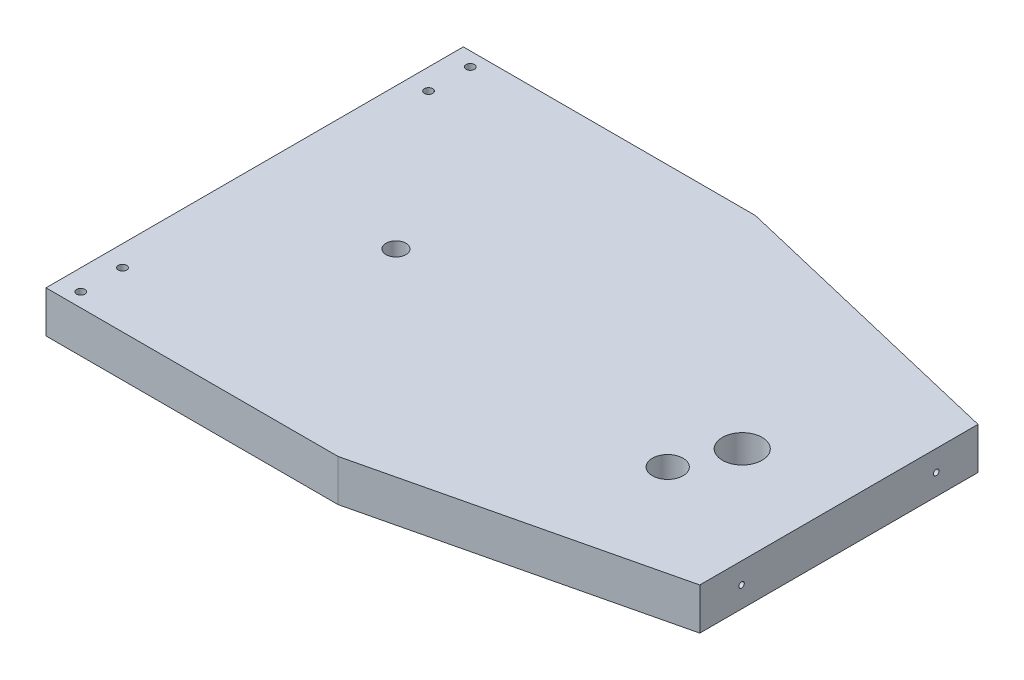
from build123d import *

# Parameters (mm, degrees)
ESBO_O1_R                = 3.571875
ESBO_O1_R_2              = 7.14
ESBO_O1_R_3              = 5.5
ESBO_O1_R_4              = 1.5
RESSALTO_EXTRUS_O1_DEPTH = 15
ESBO_O2_R                = 1
CORTE_EXTRUS_O1_DEPTH    = 10


with BuildPart() as part:
    # Esboço1 → Ressalto-extrusão1 (new body)
    with BuildSketch(Plane(origin=(0, 0, 0), x_dir=(1, 0, 0), z_dir=(0, 1, 0))):
        Polygon((210, 50), (105, 75), (0, 75), (0, -75), (105, -75), (210, -50), align=None)
        with Locations((50.8, 0)):
            Circle(ESBO_O1_R, mode=Mode.SUBTRACT)
        with Locations((175.26, 0)):
            Circle(ESBO_O1_R_2, mode=Mode.SUBTRACT)
        with Locations((167.506951951, -19.04332352)):
            Circle(ESBO_O1_R_3, mode=Mode.SUBTRACT)
        with Locations((7.5, -70)):
            Circle(ESBO_O1_R_4, mode=Mode.SUBTRACT)
        with Locations((7.5, -55)):
            Circle(ESBO_O1_R_4, mode=Mode.SUBTRACT)
        with Locations((7.5, 55)):
            Circle(ESBO_O1_R_4, mode=Mode.SUBTRACT)
        with Locations((7.5, 70)):
            Circle(ESBO_O1_R_4, mode=Mode.SUBTRACT)
    extrude(amount=RESSALTO_EXTRUS_O1_DEPTH)

    # Esboço2 → Corte-extrusão1 (cut)
    with BuildSketch(Plane(origin=(210, 0, 0), x_dir=(0, 0, -1), z_dir=(1, 0, 0))):
        with Locations((35, 7.5)):
            Circle(ESBO_O2_R)
        with Locations((-35, 7.5)):
            Circle(ESBO_O2_R)
    extrude(amount=-CORTE_EXTRUS_O1_DEPTH, mode=Mode.SUBTRACT)


solid = part.part
